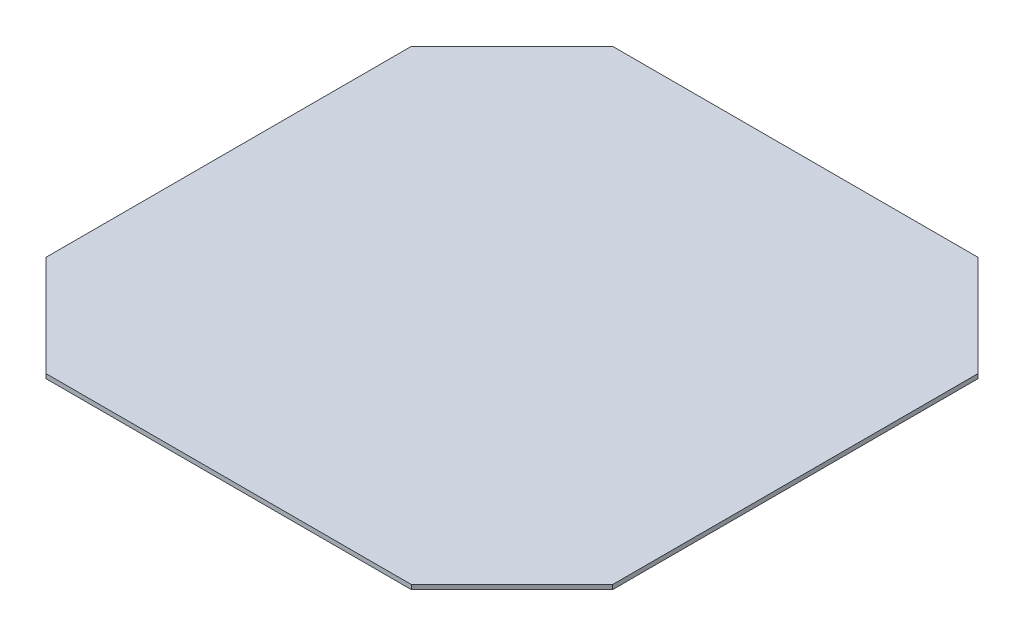
from build123d import *

# Parameters (mm, degrees)
SKETCH1_W            = 1212.85
SKETCH1_H            = 1212.85
BOSS_EXTRUDE1_DEPTH  = 9.525
CUT_EXTRUDE1_REACH   = 859.667
SKETCH2_R            = 152.4
CUT_EXTRUDE2_DEPTH   = 858.66735211
MIRROR2_COPY_1_DEPTH = 858.66735211


with BuildPart() as part:
    # Sketch1 → Boss-Extrude1 (new body)
    with BuildSketch(Plane(origin=(0, 0, 0), x_dir=(1, 0, 0), z_dir=(0, 1, 0))):
        Rectangle(SKETCH1_W, SKETCH1_H)
    extrude(amount=BOSS_EXTRUDE1_DEPTH)

    # Sketch2 → Cut-Extrude1 (cut, up to next)
    with BuildSketch(Plane(origin=(0, 9.525, 0), x_dir=(1, 0, 0), z_dir=(0, 1, 0)), mode=Mode.PRIVATE) as cut_extrude1_sk1:
        with Locations((-606.425, 606.425)):
            Circle(SKETCH2_R)
    cut_extrude1_tool1 = extrude(cut_extrude1_sk1.sketch, amount=-CUT_EXTRUDE1_REACH, mode=Mode.PRIVATE) & part.part
    # Sketch2 → Cut-Extrude1 (cut, up to next)
    with BuildSketch(Plane(origin=(0, 9.525, 0), x_dir=(1, 0, 0), z_dir=(0, 1, 0)), mode=Mode.PRIVATE) as cut_extrude1_sk2:
        with Locations((-606.425, -606.425)):
            Circle(SKETCH2_R)
    cut_extrude1_tool2 = extrude(cut_extrude1_sk2.sketch, amount=-CUT_EXTRUDE1_REACH, mode=Mode.PRIVATE) & part.part
    # Sketch2 → Cut-Extrude1 (cut, up to next)
    with BuildSketch(Plane(origin=(0, 9.525, 0), x_dir=(1, 0, 0), z_dir=(0, 1, 0)), mode=Mode.PRIVATE) as cut_extrude1_sk3:
        with Locations((606.425, -606.425)):
            Circle(SKETCH2_R)
    cut_extrude1_tool3 = extrude(cut_extrude1_sk3.sketch, amount=-CUT_EXTRUDE1_REACH, mode=Mode.PRIVATE) & part.part
    # Sketch2 → Cut-Extrude1 (cut, up to next)
    with BuildSketch(Plane(origin=(0, 9.525, 0), x_dir=(1, 0, 0), z_dir=(0, 1, 0)), mode=Mode.PRIVATE) as cut_extrude1_sk4:
        with Locations((606.425, 606.425)):
            Circle(SKETCH2_R)
    cut_extrude1_tool4 = extrude(cut_extrude1_sk4.sketch, amount=-CUT_EXTRUDE1_REACH, mode=Mode.PRIVATE) & part.part
    add(cut_extrude1_tool1.solids().sort_by_distance((-606.425, 9.525, -606.425))[0], mode=Mode.SUBTRACT)
    add(cut_extrude1_tool2.solids().sort_by_distance((-606.425, 9.525, 606.425))[0], mode=Mode.SUBTRACT)
    add(cut_extrude1_tool3.solids().sort_by_distance((606.425, 9.525, 606.425))[0], mode=Mode.SUBTRACT)
    add(cut_extrude1_tool4.solids().sort_by_distance((606.425, 9.525, -606.425))[0], mode=Mode.SUBTRACT)

    # Sketch3 → Cut-Extrude2 (cut, symmetric)
    with BuildSketch(Plane(origin=(0, 9.525, 0), x_dir=(1, 0, 0), z_dir=(0, 1, 0))):
        Polygon((-1836.829770691, 2834.153623785), (390.898853094, 606.425), (606.425, 390.898853094), (2834.153623785, -1836.829770691), (7289.610871356, 2618.62747688), (2618.62747688, 7289.610871356), align=None)
    cut_extrude2 = extrude(amount=CUT_EXTRUDE2_DEPTH, both=True, mode=Mode.SUBTRACT)

    # Mirror1: Cut-Extrude2 across plane
    add(cut_extrude2.mirror(Plane.XY), mode=Mode.SUBTRACT)

    # Mirror2: Cut-Extrude2 across plane
    add(cut_extrude2.mirror(Plane(origin=(0, 0, 0), x_dir=(0, 0, 1), z_dir=(1, 0, 0))), mode=Mode.SUBTRACT)

    # Mirror2 copy 1 sketch → Mirror2 copy 1 (cut, symmetric)
    with BuildSketch(Plane(origin=(0, 9.525, 0), x_dir=(-1, 0, 0), z_dir=(0, 1, 0))):
        Polygon((-1836.829770691, 2834.153623785), (390.898853094, 606.425), (606.425, 390.898853094), (2834.153623785, -1836.829770691), (7289.610871356, 2618.62747688), (2618.62747688, 7289.610871356), align=None)
    extrude(amount=MIRROR2_COPY_1_DEPTH, both=True, mode=Mode.SUBTRACT)


solid = part.part
